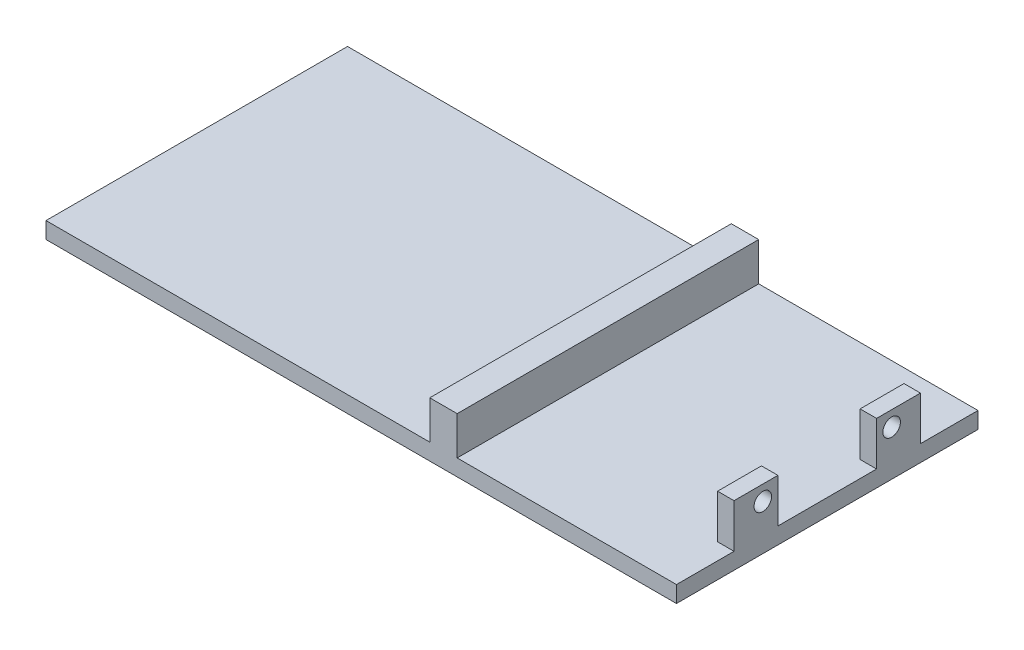
from build123d import *

# Parameters (mm, degrees)
SKETCH2_W           = 70
SKETCH2_H           = 55
BOSS_EXTRUDE3_DEPTH = 3
SKETCH5_W           = 5
SKETCH5_H           = 55
BOSS_EXTRUDE4_DEPTH = 10
SKETCH6_W           = 40
SKETCH6_H           = 55
BOSS_EXTRUDE5_DEPTH = 3
SKETCH8_W           = 3
SKETCH8_H           = 8
BOSS_EXTRUDE6_DEPTH = 11
SKETCH9_R           = 1.6
CUT_EXTRUDE1_DEPTH  = 11


with BuildPart() as part:
    # Sketch2 → Boss-Extrude3 (new body)
    with BuildSketch(Plane(origin=(0, 0, 0), x_dir=(1, 0, 0), z_dir=(0, 1, 0))):
        with Locations((4.454545455, 9.045454545)):
            Rectangle(SKETCH2_W, SKETCH2_H)
    extrude(amount=BOSS_EXTRUDE3_DEPTH)

    # Sketch5 → Boss-Extrude4 (add)
    with BuildSketch(Plane(origin=(0, 0, 0), x_dir=(1, 0, 0), z_dir=(0, 1, 0))):
        with Locations((41.954545455, 9.045454545)):
            Rectangle(SKETCH5_W, SKETCH5_H)
    extrude(amount=BOSS_EXTRUDE4_DEPTH)

    # Sketch6 → Boss-Extrude5 (add)
    with BuildSketch(Plane(origin=(0, 0, 0), x_dir=(1, 0, 0), z_dir=(0, 1, 0))):
        with Locations((64.454545455, 9.045454545)):
            Rectangle(SKETCH6_W, SKETCH6_H)
    extrude(amount=BOSS_EXTRUDE5_DEPTH)

    # Sketch8 → Boss-Extrude6 (add)
    with BuildSketch(Plane(origin=(0, 0, 0), x_dir=(1, 0, 0), z_dir=(0, 1, 0))):
        with Locations((82.954545455, 22.045454545)):
            Rectangle(SKETCH8_W, SKETCH8_H)
        with Locations((82.954545455, -3.954545455)):
            Rectangle(SKETCH8_W, SKETCH8_H)
    extrude(amount=BOSS_EXTRUDE6_DEPTH)

    # Sketch9 → Cut-Extrude1 (cut)
    with BuildSketch(Plane(origin=(84.454545455, 0, 0), x_dir=(0, 0, -1), z_dir=(1, 0, 0))):
        with Locations((-2.704545455, 8.25)):
            Circle(SKETCH9_R)
        with Locations((20.795454545, 8.25)):
            Circle(SKETCH9_R)
    extrude(amount=-CUT_EXTRUDE1_DEPTH, mode=Mode.SUBTRACT)


solid = part.part
